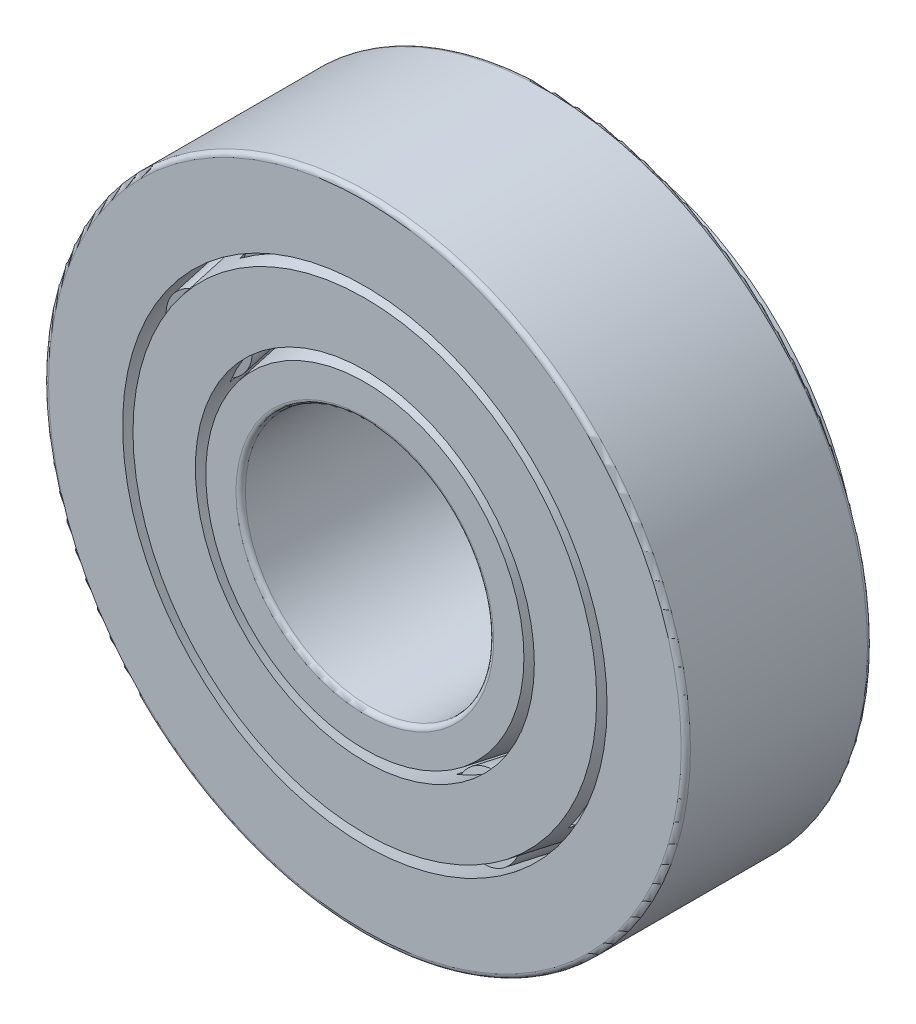
from build123d import *

# Parameters (mm, degrees)
CIRPATTERN1_COUNT = 12
CIRPATTERN2_COUNT = 12
CIRPATTERN2_ANGLE = 330
FILLET1_R         = 0.3571875
FILLET2_R         = 0.3571875


with BuildPart() as part:
    # Sketch1 → Revolve1 (revolve)
    with BuildSketch(Plane(origin=(0, 0, 0), x_dir=(0, 0, -1), z_dir=(1, 0, 0))):
        Polygon((-9.525, 24.6126), (4.7625, 24.6126), (4.7625, 21.096831737), (-9.525, 18.57756), align=None)
    revolve(axis=Axis((0, 0, 9.525), (0, 0, -1)))

    # Fillet1
    fillet1_edges = [part.edges().sort_by_distance(p)[0] for p in [
        (0, -24.6126, -4.7625),
        (0, -24.6126, 9.525),
    ]]
    fillet(fillet1_edges, radius=FILLET1_R)


with BuildPart() as body_2:
    # Sketch5 → Revolve4 (revolve)
    with BuildSketch(Plane(origin=(0, 0, 0), x_dir=(0, 0, -1), z_dir=(1, 0, 0))):
        Polygon((9.525, 15.56004), (-9.525, 12.201011018), (-9.525, 9.525), (9.525, 9.525), align=None)
    revolve(axis=Axis((0, 0, 9.525), (0, 0, -1)))

    # Fillet2
    fillet2_edges = [body_2.edges().sort_by_distance(p)[0] for p in [
        (0, -9.525, -9.525),
        (0, -9.525, 9.525),
    ]]
    fillet(fillet2_edges, radius=FILLET2_R)


with BuildPart() as body_3:
    # Sketch2 → Revolve2 (revolve)
    with BuildSketch(Plane(origin=(0, 0, 0), x_dir=(0, 0, -1), z_dir=(1, 0, 0))):
        Polygon((-9.525, 17.780491377), (-9.525, 12.99807964), (4.7625, 15.517351377), (8.372693238, 16.153925851), (7.554852664, 20.792130228), (4.7625, 20.299763114), align=None)
    revolve(axis=Axis((0, 0, 9.525), (0, 0, -1)))

    # Sketch3 → Cut-Revolve1 (revolve, cut)
    with BuildSketch(Plane(origin=(0, 0, 0), x_dir=(0, 0, -1), z_dir=(1, 0, 0))):
        Polygon((-7.889318852, 15.677700227), (-8.434545902, 18.769836479), (4.217272951, 21.000693497), (4.7625, 17.908557246), align=None)
    cut_revolve1 = revolve(axis=Axis((0, 15.389285509, 9.525), (0, 0.17364817766692786, -0.9848077530122086)), mode=Mode.SUBTRACT)

    # CirPattern1: Cut-Revolve1 ×12 about axis
    cirpattern1_axis = Axis((0, 0, -9.525), (0, 0, 1))
    for i in range(1, CIRPATTERN1_COUNT):
        add(cut_revolve1.rotate(cirpattern1_axis, i * 360 / CIRPATTERN1_COUNT), mode=Mode.SUBTRACT)


with BuildPart() as body_4:
    # Sketch4 → Revolve3 (revolve)
    with BuildSketch(Plane(origin=(0, 0, 0), x_dir=(0, 0, -1), z_dir=(1, 0, 0))):
        Polygon((-8.390439264, 18.51969531), (4.261379588, 20.750552328), (4.7625, 17.908557246), (-7.889318852, 15.677700227), align=None)
    revolve(axis=Axis((0, 15.389285509, 9.525), (0, 0.17364817766692786, -0.9848077530122086)))


with BuildPart() as cirpattern2_1:
    # CirPattern2: pattern copy
    add(body_4.part.rotate(Axis((0, 0, -9.525), (0, 0, 1)), 1 * CIRPATTERN2_ANGLE / (CIRPATTERN2_COUNT - 1)))


with BuildPart() as cirpattern2_2:
    # CirPattern2: pattern copy
    add(body_4.part.rotate(Axis((0, 0, -9.525), (0, 0, 1)), 2 * CIRPATTERN2_ANGLE / (CIRPATTERN2_COUNT - 1)))


with BuildPart() as cirpattern2_3:
    # CirPattern2: pattern copy
    add(body_4.part.rotate(Axis((0, 0, -9.525), (0, 0, 1)), 3 * CIRPATTERN2_ANGLE / (CIRPATTERN2_COUNT - 1)))


with BuildPart() as cirpattern2_4:
    # CirPattern2: pattern copy
    add(body_4.part.rotate(Axis((0, 0, -9.525), (0, 0, 1)), 4 * CIRPATTERN2_ANGLE / (CIRPATTERN2_COUNT - 1)))


with BuildPart() as cirpattern2_5:
    # CirPattern2: pattern copy
    add(body_4.part.rotate(Axis((0, 0, -9.525), (0, 0, 1)), 5 * CIRPATTERN2_ANGLE / (CIRPATTERN2_COUNT - 1)))


with BuildPart() as cirpattern2_6:
    # CirPattern2: pattern copy
    add(body_4.part.rotate(Axis((0, 0, -9.525), (0, 0, 1)), 6 * CIRPATTERN2_ANGLE / (CIRPATTERN2_COUNT - 1)))


with BuildPart() as cirpattern2_7:
    # CirPattern2: pattern copy
    add(body_4.part.rotate(Axis((0, 0, -9.525), (0, 0, 1)), 7 * CIRPATTERN2_ANGLE / (CIRPATTERN2_COUNT - 1)))


with BuildPart() as cirpattern2_8:
    # CirPattern2: pattern copy
    add(body_4.part.rotate(Axis((0, 0, -9.525), (0, 0, 1)), 8 * CIRPATTERN2_ANGLE / (CIRPATTERN2_COUNT - 1)))


with BuildPart() as cirpattern2_9:
    # CirPattern2: pattern copy
    add(body_4.part.rotate(Axis((0, 0, -9.525), (0, 0, 1)), 9 * CIRPATTERN2_ANGLE / (CIRPATTERN2_COUNT - 1)))


with BuildPart() as cirpattern2_10:
    # CirPattern2: pattern copy
    add(body_4.part.rotate(Axis((0, 0, -9.525), (0, 0, 1)), 10 * CIRPATTERN2_ANGLE / (CIRPATTERN2_COUNT - 1)))


with BuildPart() as cirpattern2_11:
    # CirPattern2: pattern copy
    add(body_4.part.rotate(Axis((0, 0, -9.525), (0, 0, 1)), 11 * CIRPATTERN2_ANGLE / (CIRPATTERN2_COUNT - 1)))


solid = Compound([part.part, body_2.part, body_3.part, body_4.part, cirpattern2_1.part, cirpattern2_2.part, cirpattern2_3.part, cirpattern2_4.part, cirpattern2_5.part, cirpattern2_6.part, cirpattern2_7.part, cirpattern2_8.part, cirpattern2_9.part, cirpattern2_10.part, cirpattern2_11.part])
